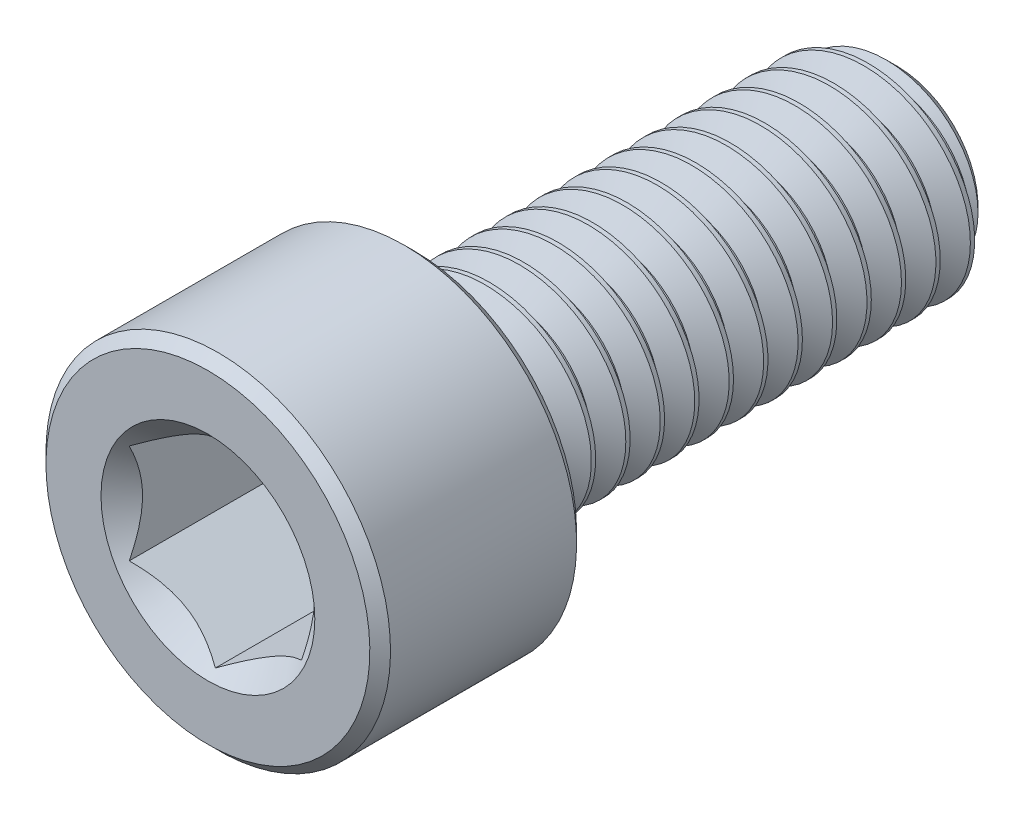
from build123d import *

# Parameters (mm, degrees)
CUT_EXTRUDE1_DEPTH     = 5
SKETCH4_R              = 3.103257697
CUT_EXTRUDE2_DEPTH     = 3
CUT_EXTRUDE2_DRAFT     = -45
SPLIT1_SURFACE_1_BACK  = 25.495
SPLIT1_SURFACE_1_DEPTH = 50.99
SPLIT1_SURFACE_2_BACK  = 25.495
SPLIT1_SURFACE_2_DEPTH = 50.99
CUT_SWEEP1_PITCH       = 1


with BuildPart() as part:
    # Sketch2 → Revolve1 (revolve)
    with BuildSketch(Plane(origin=(0, 0, 0), x_dir=(0, 0, -1), z_dir=(1, 0, 0))):
        with BuildLine():
            Line((-10, 0), (-10, 4.7))
            Line((-10, 4.7), (-9.7, 5))
            Line((-9.7, 5), (-4.3, 5))
            Line((-4.3, 5), (-4, 4.7))
            Line((-4, 4.7), (-4, 3.3))
            ThreePointArc((-4, 3.3), (-3.912132034, 3.087867966), (-3.7, 3))
            Line((-3.7, 3), (9.350480947, 3))
            Line((9.350480947, 3), (10, 2.350480947))
            Line((10, 2.350480947), (10, 0))
            Line((10, 0), (-10, 0))
        make_face()
    revolve(axis=Axis((0, 0, -10), (0, 0, 1)))

    # Sketch3 → Cut-Extrude1 (cut)
    with BuildSketch(Plane.XY.offset(10)):
        Polygon((2.5, -1.443375673), (2.5, 1.443375673), (0, 2.886751346), (-2.5, 1.443375673), (-2.5, -1.443375673), (0, -2.886751346), align=None)
    extrude(amount=-CUT_EXTRUDE1_DEPTH, mode=Mode.SUBTRACT)


with BuildPart() as cut_extrude2_tool:
    # Sketch4 → Cut-Extrude2 (with draft: the straight prism first)
    with BuildSketch(Plane.XY.offset(10)):
        Circle(SKETCH4_R)
    extrude(amount=-CUT_EXTRUDE2_DEPTH)
    # Cut-Extrude2: the draft: its side faces are tilted about the plane it starts from
    cut_extrude2_sides = [cut_extrude2_tool.faces().sort_by_distance(p)[0] for p in [
        (-3.103257697, 0, 8.5),
    ]]
    draft(cut_extrude2_sides, Plane.XY.offset(10), CUT_EXTRUDE2_DRAFT)


with BuildPart() as part_1:
    add(part.part)

    # Cut-Extrude2: cut by cut_extrude2_tool
    add(cut_extrude2_tool.part, mode=Mode.SUBTRACT)


with BuildPart() as body_2:
    # Split1: the piece behind the surface
    add(part_1.part)
    # Split1 surface: a surface, the sketch's curves swept straight by 50.99 mm
    with BuildLine(Plane(origin=(0, 0, 0), x_dir=(0, 0, -1), z_dir=(1, 0, 0)).offset(-SPLIT1_SURFACE_1_BACK), mode=Mode.PRIVATE) as split1_surface_1_path:
        Line((-3.7, -5), (-3.7, 5))
    split1_surface_1 = Shell.extrude(split1_surface_1_path.wire(), (1 * SPLIT1_SURFACE_1_DEPTH, 0 * SPLIT1_SURFACE_1_DEPTH, 0 * SPLIT1_SURFACE_1_DEPTH))
    split(bisect_by=split1_surface_1, keep=Keep.BOTTOM)

    # Cut-Sweep1: the profile of Sketch7 screwed along a right-hand helix of 15 turns, 8 arcs to a turn; built about Z, then put on its axis
    cut_sweep1_z = Axis((0, 0, 0), (0, 0, 1))
    cut_sweep1_corners = [(3.054126588, 0, 0.03125), (3.054126588, 0, -0.90625), (2.350480947, 0, -0.5), (2.350480947, 0, -0.375)]
    with BuildLine(mode=Mode.PRIVATE) as cut_sweep1_profile:
        Line(cut_sweep1_corners[0], cut_sweep1_corners[1])
        Line(cut_sweep1_corners[1], cut_sweep1_corners[2])
        Line(cut_sweep1_corners[2], cut_sweep1_corners[3])
        Line(cut_sweep1_corners[3], cut_sweep1_corners[0])
    cut_sweep1_cap = Face(cut_sweep1_profile.wire())
    cut_sweep1_turn_angles = [0, 22.5, 45, 67.5, 90, 112.5, 135, 157.5, 180, 202.5, 225, 247.5, 270, 292.5, 315, 337.5, 360]
    cut_sweep1_turn_weights = [1, 0.9238795325112867, 1, 0.9238795325112867, 1, 0.9238795325112867, 1, 0.9238795325112867, 1, 0.9238795325112867, 1, 0.9238795325112867, 1, 0.9238795325112867, 1, 0.9238795325112867, 1]
    cut_sweep1_turn_rails = [Edge.make_bspline([Vector(p[0], p[1], 0).rotate(cut_sweep1_z, cut_sweep1_turn_angles[k]) / cut_sweep1_turn_weights[k] + Vector(0, 0, p[2] + CUT_SWEEP1_PITCH * cut_sweep1_turn_angles[k] / 360) for k in range(17)], [0, 0, 0, 1, 1, 2, 2, 3, 3, 4, 4, 5, 5, 6, 6, 7, 7, 8, 8, 8], 2, cut_sweep1_turn_weights) for p in cut_sweep1_corners]
    cut_sweep1_turn_sides = [Face.make_surface_from_curves(cut_sweep1_turn_rails[p[0]], cut_sweep1_turn_rails[p[1]]) for p in [(0, 1), (1, 2), (2, 3), (3, 0)]]
    cut_sweep1 = Plane(origin=(0, 0, -10), x_dir=(0, 1, 0), z_dir=(0, 0, 1)) * Solid(Shell([*[p.moved(Location((0, 0, CUT_SWEEP1_PITCH * i))) for i in range(15) for p in cut_sweep1_turn_sides], cut_sweep1_cap, cut_sweep1_cap.rotate(cut_sweep1_z, 5400).moved(Location((0, 0, CUT_SWEEP1_PITCH * 5400 / 360)))]))
    add(cut_sweep1, mode=Mode.SUBTRACT)


with BuildPart() as part_2:
    add(part_1.part)

    # Split1: split by a surface, the side it looks to stays
    # Split1 surface: a surface, the sketch's curves swept straight by 50.99 mm
    with BuildLine(Plane(origin=(0, 0, 0), x_dir=(0, 0, -1), z_dir=(1, 0, 0)).offset(-SPLIT1_SURFACE_2_BACK), mode=Mode.PRIVATE) as split1_surface_2_path:
        Line((-3.7, -5), (-3.7, 5))
    split1_surface_2 = Shell.extrude(split1_surface_2_path.wire(), (1 * SPLIT1_SURFACE_2_DEPTH, 0 * SPLIT1_SURFACE_2_DEPTH, 0 * SPLIT1_SURFACE_2_DEPTH))
    split(bisect_by=split1_surface_2, keep=Keep.TOP)

    add(body_2.part)  # Revolve2 merges body 2
    # Sketch8 → Revolve2 (revolve)
    with BuildSketch(Plane(origin=(0, 0, 0), x_dir=(0, 0, -1), z_dir=(1, 0, 0))):
        Polygon((-4, 0), (-4, 3), (-3.7, 3), (-1.967949192, 0), align=None)
    revolve(axis=Axis((0, 0, 1.967949192), (0, 0, 1)))


solid = part_2.part
